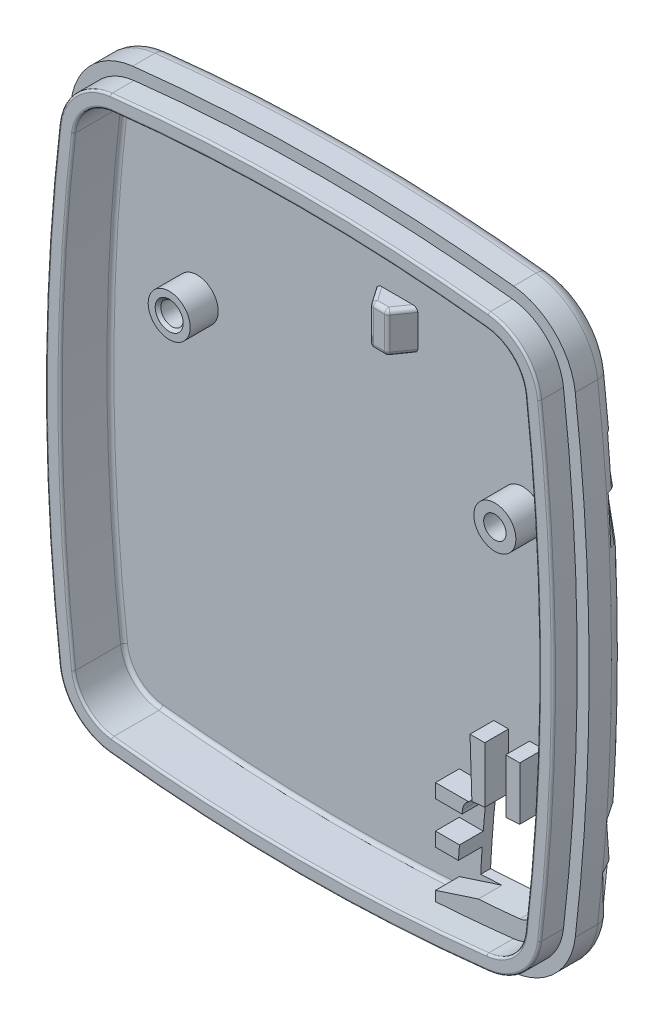
from build123d import *

# Parameters (mm, degrees)
IZIM1_W                           = 38
IZIM1_H                           = 44
Y_KSEKLIK_EKSTR_ZYON1_DEPTH       = 1.3
KES_EKSTR_ZYON1_DEPTH             = 30.184927617
KES_EKSTR_ZYON2_DEPTH             = 30.184927617
RADYUS1_R                         = 5
RADYUS2_R                         = 1
BO_ALTMA1_T                       = -0.7
Y_KSEKLIK_EKSTR_ZYON10_DEPTH      = 1.7
Y_KSEKLIK_EKSTR_ZYON10_DEPTH_BACK = 1.9
KES_EKSTR_ZYON5_DEPTH             = 1.7
RADYUS3_R                         = 0.15
IZIM14_R                          = 1.5
IZIM14_R_2                        = 0.8
Y_KSEKLIK_EKSTR_ZYON13_DEPTH      = 2
RADYUS6_R                         = 0.25
Y_KSEKLIK_EKSTR_ZYON15_DEPTH      = 1.1
Y_KSEKLIK_EKSTR_ZYON15_DEPTH_BACK = 0.2
IZIM17_W                          = 3.777976332
IZIM17_H                          = 2.881557519
Y_KSEKLIK_EKSTR_ZYON16_DEPTH      = 2.4
Y_KSEKLIK_EKSTR_ZYON18_OUTLINE_W  = 4.462087673
Y_KSEKLIK_EKSTR_ZYON18_OUTLINE_H  = 1.556542211
Y_KSEKLIK_EKSTR_ZYON18_DEPTH      = 0.4
Y_KSEKLIK_EKSTR_ZYON19_START      = -1.935
Y_KSEKLIK_EKSTR_ZYON19_OUTLINE_R  = 0.75
Y_KSEKLIK_EKSTR_ZYON19_DEPTH      = 0.635
RADYUS9_R                         = 0.6
PAH1_SIZE                         = 0.2
PAH2_SIZE                         = 1.9
PAH2_SIZE_2                       = 1.330394323
RADYUS10_R                        = 0.3
RADYUS11_R                        = 1.7
Y_KSEKLIK_EKSTR_ZYON22_DEPTH      = 0.1
Y_KSEKLIK_EKSTR_ZYON22_DEPTH_BACK = 0.2
IZIM33_R                          = 4
IZIM34_R                          = 0.763160631
Y_KSEKLIK_EKSTR_ZYON23_DEPTH      = 0.2
KES_EKSTR_ZYON7_DEPTH             = 10
IZIM36_W                          = 4
IZIM36_H                          = 2
IZIM36_W_2                        = 1.5
IZIM36_H_2                        = 4.5
KES_EKSTR_ZYON8_DEPTH             = 1.7


# Read off the part's stored shape, not the designer's step: Yükseklik-Ekstrüzyon18, Yükseklik-Ekstrüzyon19
with BuildPart() as part:
    # Çizim1 → Yükseklik-Ekstrüzyon1 (new, symmetric)
    with BuildSketch(Plane.XY):
        Rectangle(IZIM1_W, IZIM1_H)
    extrude(amount=Y_KSEKLIK_EKSTR_ZYON1_DEPTH, both=True)

    # Çizim2 → Kes-Ekstrüzyon1 (cut, through all)
    with BuildSketch(Plane.XY.offset(1.3)):
        with BuildLine():
            Line((19, 22), (0, 22))
            ThreePointArc((0, 22), (9.529559276, 21.624417499), (19, 20.5))
            Line((19, 20.5), (19, 22))
        make_face()
        with BuildLine():
            Line((0, 22), (-19, 22))
            Line((-19, 22), (-19, 20.5))
            ThreePointArc((-19, 20.5), (-9.529559276, 21.624417499), (0, 22))
        make_face()
        with BuildLine():
            ThreePointArc((0, -22), (-9.529559276, -21.624417499), (-19, -20.5))
            Line((-19, -20.5), (-19, -22))
            Line((-19, -22), (0, -22))
        make_face()
        with BuildLine():
            Line((19, -22), (19, -20.5))
            ThreePointArc((19, -20.5), (9.529559276, -21.624417499), (0, -22))
            Line((0, -22), (19, -22))
        make_face()
    extrude(amount=-KES_EKSTR_ZYON1_DEPTH, mode=Mode.SUBTRACT)

    # Çizim3 → Kes-Ekstrüzyon2 (cut, through all)
    with BuildSketch(Plane.XY.offset(1.3)):
        with BuildLine():
            Line((19, 0), (19, 20.5))
            ThreePointArc((19, 20.5), (18.250358245, 20.61670023), (17.5, 20.728701167))
            ThreePointArc((17.5, 20.728701167), (18.624510362, 10.391451439), (19, 0))
        make_face()
        with BuildLine():
            Line((19, -20.5), (19, 0))
            ThreePointArc((19, 0), (18.624510362, -10.391451439), (17.5, -20.728701167))
            ThreePointArc((17.5, -20.728701167), (18.250358245, -20.61670023), (19, -20.5))
        make_face()
        with BuildLine():
            ThreePointArc((-19, -20.5), (-18.250358245, -20.61670023), (-17.5, -20.728701167))
            ThreePointArc((-17.5, -20.728701167), (-18.624510362, -10.391451439), (-19, 0))
            Line((-19, 0), (-19, -20.5))
        make_face()
        with BuildLine():
            ThreePointArc((-19, 0), (-18.624510362, 10.391451439), (-17.5, 20.728701167))
            ThreePointArc((-17.5, 20.728701167), (-18.250358245, 20.61670023), (-19, 20.5))
            Line((-19, 20.5), (-19, 0))
        make_face()
    extrude(amount=-KES_EKSTR_ZYON2_DEPTH, mode=Mode.SUBTRACT)

    # Radyus1
    radyus1_edges = [part.edges().sort_by_distance(p)[0] for p in [
        (17.5, 20.728701167, 0),
        (17.5, -20.728701167, 0),
        (-17.5, -20.728701167, 0),
        (-17.5, 20.728701167, 0),
    ]]
    fillet(radyus1_edges, radius=RADYUS1_R)

    # Radyus2
    radyus2_edges = [part.edges().sort_by_distance(p)[0] for p in [
        (-19, 0, -1.3),
        (0, -22, -1.3),
        (0, 22, -1.3),
        (19, 0, -1.3),
        (16.572210545, 19.808510803, -1.3),
        (-16.572210545, 19.808510803, -1.3),
        (16.572210545, -19.808510803, -1.3),
        (-16.572210545, -19.808510803, -1.3),
    ]]
    fillet(radyus2_edges, radius=RADYUS2_R)

    # İç Boşaltma1
    bo_altma1_openings = [part.faces().sort_by_distance(p)[0] for p in [
        (0, 0, 1.3),
    ]]
    offset(amount=BO_ALTMA1_T, openings=bo_altma1_openings)



with BuildPart() as body_2:
    # Çizim10 → Yükseklik-Ekstrüzyon10 (new, two sides: drawn at the far end of the back side and taken through both)
    with BuildSketch(Plane.XY.offset(1.3).offset(-Y_KSEKLIK_EKSTR_ZYON10_DEPTH_BACK)):
        with BuildLine():
            ThreePointArc((-17.315423097, -16.767939039), (-16.07839717, -19.312377404), (-13.528188636, -20.53746359))
            ThreePointArc((-13.528188636, -20.53746359), (0, -21.3), (13.528188636, -20.53746359))
            ThreePointArc((13.528188636, -20.53746359), (16.07839717, -19.312377404), (17.315423097, -16.767939039))
            ThreePointArc((17.315423097, -16.767939039), (18.3, 0), (17.315423097, 16.767939039))
            ThreePointArc((17.315423097, 16.767939039), (16.07839717, 19.312377404), (13.528188636, 20.53746359))
            ThreePointArc((13.528188636, 20.53746359), (0, 21.3), (-13.528188636, 20.53746359))
            ThreePointArc((-13.528188636, 20.53746359), (-16.07839717, 19.312377404), (-17.315423097, 16.767939039))
            ThreePointArc((-17.315423097, 16.767939039), (-18.3, 0), (-17.315423097, -16.767939039))
        make_face()
        with BuildLine():
            ThreePointArc((13.393337524, 19.345064673), (0, 20.1), (-13.393337524, 19.345064673))
            ThreePointArc((-13.393337524, 19.345064673), (-15.231859956, 18.461863004), (-16.123669345, 16.627500462))
            ThreePointArc((-16.123669345, 16.627500462), (-17.1, 0), (-16.123669345, -16.627500462))
            ThreePointArc((-16.123669345, -16.627500462), (-15.231859956, -18.461863004), (-13.393337524, -19.345064673))
            ThreePointArc((-13.393337524, -19.345064673), (0, -20.1), (13.393337524, -19.345064673))
            ThreePointArc((13.393337524, -19.345064673), (15.231859956, -18.461863004), (16.123669345, -16.627500462))
            ThreePointArc((16.123669345, -16.627500462), (17.1, 0), (16.123669345, 16.627500462))
            ThreePointArc((16.123669345, 16.627500462), (15.231859956, 18.461863004), (13.393337524, 19.345064673))
        make_face(mode=Mode.SUBTRACT)
    extrude(amount=Y_KSEKLIK_EKSTR_ZYON10_DEPTH + Y_KSEKLIK_EKSTR_ZYON10_DEPTH_BACK)

    # Çizim13 → Kes-Ekstrüzyon5 (cut)
    with BuildSketch(Plane.XY.offset(3)):
        with BuildLine():
            ThreePointArc((-17.315423097, 16.767939039), (-18.3, 0), (-17.315423097, -16.767939039))
            ThreePointArc((-17.315423097, -16.767939039), (-16.07839717, -19.312377404), (-13.528188636, -20.53746359))
            ThreePointArc((-13.528188636, -20.53746359), (0, -21.3), (13.528188636, -20.53746359))
            ThreePointArc((13.528188636, -20.53746359), (16.07839717, -19.312377404), (17.315423097, -16.767939039))
            ThreePointArc((17.315423097, -16.767939039), (18.3, 0), (17.315423097, 16.767939039))
            ThreePointArc((17.315423097, 16.767939039), (16.07839717, 19.312377404), (13.528188636, 20.53746359))
            ThreePointArc((13.528188636, 20.53746359), (0, 21.3), (-13.528188636, 20.53746359))
            ThreePointArc((-13.528188636, 20.53746359), (-16.07839717, 19.312377404), (-17.315423097, 16.767939039))
        make_face()
        with BuildLine():
            ThreePointArc((13.511332247, 20.388413726), (0, 21.15), (-13.511332247, 20.388413726))
            ThreePointArc((-13.511332247, 20.388413726), (-15.972580018, 19.206063104), (-17.166453878, 16.750384217))
            ThreePointArc((-17.166453878, 16.750384217), (-18.15, 0), (-17.166453878, -16.750384217))
            ThreePointArc((-17.166453878, -16.750384217), (-15.972580018, -19.206063104), (-13.511332247, -20.388413726))
            ThreePointArc((-13.511332247, -20.388413726), (0, -21.15), (13.511332247, -20.388413726))
            ThreePointArc((13.511332247, -20.388413726), (15.972580018, -19.206063104), (17.166453878, -16.750384217))
            ThreePointArc((17.166453878, -16.750384217), (18.15, 0), (17.166453878, 16.750384217))
            ThreePointArc((17.166453878, 16.750384217), (15.972580018, 19.206063104), (13.511332247, 20.388413726))
        make_face(mode=Mode.SUBTRACT)
    extrude(amount=-KES_EKSTR_ZYON5_DEPTH, mode=Mode.SUBTRACT)

    # Radyus3
    radyus3_edges = [body_2.edges().sort_by_distance(p)[0] for p in [
        (15.231859956, 18.461863004, 3),
        (0, 20.1, 3),
        (-15.231859956, 18.461863004, 3),
        (-17.1, 0, 3),
        (-15.231859956, -18.461863004, 3),
        (0, -20.1, 3),
        (15.231859956, -18.461863004, 3),
        (17.1, 0, 3),
        (15.972580018, 19.206063104, 3),
        (18.15, 0, 3),
        (15.972580018, -19.206063104, 3),
        (0, -21.15, 3),
        (-15.972580018, -19.206063104, 3),
        (-18.15, 0, 3),
        (-15.972580018, 19.206063104, 3),
        (0, 21.15, 3),
    ]]
    fillet(radyus3_edges, radius=RADYUS3_R)


with BuildPart() as part_1:
    add(part.part)

    add(body_2.part)  # Yükseklik-Ekstrüzyon13 merges body 2
    # Çizim14 → Yükseklik-Ekstrüzyon13 (add)
    # profile 1 of 2: a face of its own
    with BuildSketch(Plane.XY.offset(-0.6)):
        with Locations(Location((-10.899348707, 7.219150932, 0), (0, 0, 180))):
            Circle(IZIM14_R)
        with Locations((-10.899348707, 7.219150932)):
            Circle(IZIM14_R_2, mode=Mode.SUBTRACT)
    # profile 2 of 2: a face of its own
    with BuildSketch(Plane.XY.offset(-0.6)):
        with Locations(Location((12.365990888, 5.750657834, 0), (0, 0, 180))):
            Circle(IZIM14_R)
        with Locations((12.365990888, 5.750657834)):
            Circle(IZIM14_R_2, mode=Mode.SUBTRACT)
    extrude(amount=Y_KSEKLIK_EKSTR_ZYON13_DEPTH)

    # Radyus6
    radyus6_edges = [part_1.edges().sort_by_distance(p)[0] for p in [
        (17.1, 0, -0.6),
        (15.231859956, 18.461863004, -0.6),
        (0, 20.1, -0.6),
        (-15.231859956, 18.461863004, -0.6),
        (-17.1, 0, -0.6),
        (-15.231859956, -18.461863004, -0.6),
        (0, -20.1, -0.6),
        (15.231859956, -18.461863004, -0.6),
    ]]
    fillet(radyus6_edges, radius=RADYUS6_R)

    # Çizim20 → Yükseklik-Ekstrüzyon16 (add)
    with BuildSketch(Plane(origin=(0, 0, -1.3), x_dir=(-1, 0, 0), z_dir=(0, 0, -1))):
        Polygon((-17.010609627, -8.248510803), (-16.75506951, -16.423522843), (-15.705648654, -18.872171507), (-13.373602307, -19.993354001), (-7.822210545, -19.993354001), (-7.822210545, -8.248510803), align=None)
    extrude(amount=-Y_KSEKLIK_EKSTR_ZYON16_DEPTH)

    # Yükseklik-Ekstrüzyon18 outline → Yükseklik-Ekstrüzyon18 (add)
    # profile 1 of 9: a face of its own
    with BuildSketch(Plane(origin=(0, 0, -1.3), x_dir=(-1, 0, 0), z_dir=(0, 0, -1))):
        with BuildLine():
            add(Edge.make_bspline(
                [(12.118367005, -9.482808521), (12.091880497, -9.48291382), (12.041867707, -9.48311265), (11.970803059, -9.485904145), (11.90831427, -9.488622522), (11.853948015, -9.493540095), (11.808151869, -9.499658497), (11.770372058, -9.507510039), (11.740978928, -9.517024279), (11.712578237, -9.530538402), (11.686317962, -9.555004828), (11.666544013, -9.593198708), (11.652900211, -9.63890303), (11.651926387, -9.672393805), (11.651404341, -9.690347482)],
                knots=[0, 0, 0, 0, 0.135204718, 0.255298483, 0.3630462, 0.45447317, 0.533879273, 0.598821629, 0.651172559, 0.691275066, 0.758648293, 0.82966591, 0.908687594, 1, 1, 1, 1], degree=3))
            Line((12.118367005, -9.482808521), (13.623024476, -9.482808521))
            Line((13.623024476, -9.482808521), (13.623024476, -8.03003579))
            Line((13.623024476, -8.03003579), (12.419136359, -8.03003579))
            add(Edge.make_bspline(
                [(11.314964228, -8.788039419), (11.317062174, -8.75801293), (11.321118336, -8.699959799), (11.332397364, -8.61654582), (11.34780333, -8.539908247), (11.366699794, -8.469939251), (11.391285928, -8.407078258), (11.419641216, -8.350796065), (11.451733054, -8.300806663), (11.500226471, -8.246113688), (11.562419933, -8.190013261), (11.633993622, -8.133335083), (11.701789418, -8.091147069), (11.759689265, -8.068191793), (11.810748879, -8.056202575), (11.86066885, -8.049293804), (11.922964144, -8.044341352), (11.997757372, -8.038133057), (12.085368812, -8.034439426), (12.185645657, -8.032272406), (12.298337357, -8.03060783), (12.377519873, -8.030232863), (12.419136359, -8.03003579)],
                knots=[0, 0, 0, 0, 0.057749972, 0.111653638, 0.161384845, 0.207685759, 0.250539078, 0.290660311, 0.328487367, 0.364148125, 0.430567385, 0.488965629, 0.539213259, 0.583221344, 0.607748032, 0.639723137, 0.679817551, 0.727663726, 0.783729083, 0.848050361, 0.920138808, 1, 1, 1, 1], degree=3))
            add(Edge.make_bspline(
                [(10.39968498, -8.03003579), (10.440773487, -8.030408375), (10.519795704, -8.03112494), (10.63350644, -8.039166316), (10.737167124, -8.052863048), (10.831106831, -8.071002989), (10.914883838, -8.095367676), (10.989349707, -8.124212349), (11.054119041, -8.158744508), (11.108967073, -8.200458649), (11.156101222, -8.248145875), (11.195756356, -8.303608511), (11.231331966, -8.365411153), (11.258847184, -8.435943945), (11.282859633, -8.512980977), (11.299309701, -8.598095345), (11.310768625, -8.690469813), (11.313533397, -8.754765146), (11.314964228, -8.788039419)],
                knots=[0, 0, 0, 0, 0.089184998, 0.171522325, 0.247270212, 0.316068583, 0.379002164, 0.436410953, 0.489174977, 0.537748439, 0.58545333, 0.634147084, 0.685372273, 0.739840404, 0.798108953, 0.860349726, 0.927727859, 1, 1, 1, 1], degree=3))
            add(Edge.make_bspline(
                [(9.160936803, -10.224598168), (9.16102192, -10.14622951), (9.161185412, -9.995699972), (9.164367327, -9.779223143), (9.17006806, -9.581402536), (9.177392544, -9.402500776), (9.185483166, -9.242669918), (9.197973132, -9.101883377), (9.211505704, -8.979953432), (9.226265955, -8.873856856), (9.247412743, -8.779719274), (9.272634382, -8.691716217), (9.306479387, -8.609109055), (9.345195666, -8.53025376), (9.391966543, -8.456758077), (9.443604586, -8.386531754), (9.502433, -8.321580214), (9.5674802, -8.260836609), (9.640896268, -8.206531127), (9.722445144, -8.157904648), (9.813989746, -8.118614126), (9.914048869, -8.086673622), (10.022541054, -8.060076957), (10.140399524, -8.0433963), (10.267016795, -8.031234422), (10.354523141, -8.030443819), (10.39968498, -8.03003579)],
                knots=[0, 0, 0, 0, 0.079725817, 0.153136352, 0.220243204, 0.281049773, 0.335292386, 0.383031116, 0.424805529, 0.460108295, 0.491924878, 0.522891582, 0.553113479, 0.582620451, 0.612140226, 0.641611317, 0.671200139, 0.701159565, 0.732005221, 0.763924969, 0.797533254, 0.833090932, 0.870698054, 0.911016939, 0.954076031, 1, 1, 1, 1], degree=3))
            Line((9.160936803, -10.224598168), (9.160936803, -11.246889694))
            Line((9.160936803, -11.246889694), (13.623024476, -11.246889694))
            Line((13.623024476, -11.246889694), (13.623024476, -9.690347482))
            Line((13.623024476, -9.690347482), (11.651404341, -9.690347482))
        make_face()
        with BuildLine():
            add(Edge.make_bspline(
                [(10.281322916, -9.482808521), (10.252890403, -9.483457227), (10.201690983, -9.484625375), (10.132772311, -9.49551634), (10.07932982, -9.513206842), (10.04205633, -9.541992902), (10.019671149, -9.576122033), (10.002791352, -9.61151538), (9.992897811, -9.650097278), (9.991701049, -9.676781819), (9.991092649, -9.690347482)],
                knots=[0, 0, 0, 0, 0.207755591, 0.374112754, 0.509202691, 0.614768302, 0.711267723, 0.804995066, 0.900865026, 1, 1, 1, 1], degree=3))
            Line((10.281322916, -9.482808521), (10.525343335, -9.482808521))
            add(Edge.make_bspline(
                [(10.873133236, -9.690347482), (10.871018555, -9.664222954), (10.866911237, -9.613481602), (10.844355334, -9.558396387), (10.817560429, -9.528737079), (10.795758621, -9.516263115), (10.76747295, -9.505968169), (10.732453243, -9.497070431), (10.690312725, -9.491168265), (10.641361666, -9.486339131), (10.585650171, -9.482985998), (10.546156504, -9.482869772), (10.525343335, -9.482808521)],
                knots=[0, 0, 0, 0, 0.166092219, 0.322598885, 0.365047389, 0.417388159, 0.479796133, 0.555892735, 0.646094533, 0.749476332, 0.867973991, 1, 1, 1, 1], degree=3))
            Line((10.873133236, -9.690347482), (9.991092649, -9.690347482))
        make_face(mode=Mode.SUBTRACT)
    # profile 2 of 9: a face of its own
    with BuildSketch(Plane(origin=(0, 0, -1.3), x_dir=(-1, 0, 0), z_dir=(0, 0, -1))):
        with BuildLine():
            add(Edge.make_bspline(
                [(9.057167322, -4.246154217), (9.058794881, -4.174214953), (9.061972731, -4.033751699), (9.084727917, -3.82810577), (9.123605114, -3.633091274), (9.177259337, -3.449336151), (9.246150074, -3.279340213), (9.331884624, -3.126914738), (9.430773225, -2.991060154), (9.545672045, -2.876394153), (9.668807183, -2.781073251), (9.797565761, -2.705889353), (9.930608523, -2.651872362), (10.047760097, -2.626951796), (10.148276192, -2.616036395), (10.236115954, -2.607870573), (10.336377205, -2.600587666), (10.448825213, -2.595040181), (10.573431172, -2.591302336), (10.710435192, -2.587790656), (10.859889801, -2.586519799), (10.963661392, -2.586073701), (11.01743767, -2.585842525)],
                knots=[0, 0, 0, 0, 0.071156086, 0.138934077, 0.204360269, 0.267628769, 0.328042607, 0.385371601, 0.440225967, 0.493719081, 0.545369064, 0.59387776, 0.640786826, 0.686772042, 0.711805655, 0.740799195, 0.77403348, 0.811237386, 0.852158453, 0.897347383, 0.946803594, 1, 1, 1, 1], degree=3))
            add(Edge.make_bspline(
                [(11.01743767, -5.854581169), (10.96393053, -5.85439323), (10.860697281, -5.854030633), (10.712073473, -5.852185362), (10.575287493, -5.850578536), (10.45076099, -5.84481203), (10.338001896, -5.840768517), (10.237226272, -5.833914774), (10.148499129, -5.827090941), (10.046507317, -5.815652242), (9.928237128, -5.791875793), (9.794007293, -5.740475071), (9.665576791, -5.668747355), (9.54322794, -5.578068126), (9.430591777, -5.468032414), (9.331988531, -5.339092826), (9.247304429, -5.193676619), (9.177864525, -5.031596605), (9.123934819, -4.854251543), (9.085555601, -4.663112247), (9.061653942, -4.458890273), (9.058690448, -4.318374247), (9.057167322, -4.246154217)],
                knots=[0, 0, 0, 0, 0.053608009, 0.103427861, 0.148920116, 0.190646336, 0.228314806, 0.261956867, 0.291838231, 0.317461837, 0.364773927, 0.412243015, 0.460839878, 0.511740483, 0.564390982, 0.618057073, 0.673872393, 0.732566435, 0.794313299, 0.859251815, 0.92766065, 1, 1, 1, 1], degree=3))
            Line((11.01743767, -5.854581169), (11.766523609, -5.854581169))
            add(Edge.make_bspline(
                [(13.726793957, -4.246154217), (13.725427858, -4.315389373), (13.722752558, -4.450976079), (13.700827, -4.649021797), (13.663519017, -4.836434329), (13.612093138, -5.012231463), (13.546521097, -5.175435679), (13.463117367, -5.322235446), (13.365403152, -5.453634555), (13.252933191, -5.566498186), (13.130743791, -5.660804348), (13.001920323, -5.734456804), (12.868012333, -5.787603552), (12.750329866, -5.813591692), (12.648381874, -5.824397243), (12.559461893, -5.832507904), (12.45812258, -5.839837736), (12.344324862, -5.845418221), (12.21782576, -5.849111313), (12.078660171, -5.852624752), (11.926773823, -5.853910905), (11.821380829, -5.854351723), (11.766523609, -5.854581169)],
                knots=[0, 0, 0, 0, 0.069361909, 0.135834932, 0.199347161, 0.260608178, 0.319138762, 0.3751603, 0.429315834, 0.482735953, 0.534295463, 0.583532345, 0.630949374, 0.67811757, 0.703744355, 0.733652727, 0.767587554, 0.805543785, 0.847806793, 0.894393145, 0.945031466, 1, 1, 1, 1], degree=3))
            add(Edge.make_bspline(
                [(11.766523609, -2.585842525), (11.819219585, -2.586042329), (11.920830577, -2.5864276), (12.067298825, -2.588115462), (12.201892513, -2.590260114), (12.324600697, -2.594213816), (12.435662084, -2.600006051), (12.53512249, -2.606387215), (12.622759642, -2.613383674), (12.723670325, -2.624805652), (12.841162352, -2.648530495), (12.975090201, -2.700255944), (13.104073121, -2.772413308), (13.226969204, -2.865134973), (13.341923116, -2.976859684), (13.442500573, -3.109446462), (13.528743134, -3.260345828), (13.600616183, -3.428489225), (13.656659998, -3.612922199), (13.698078157, -3.811440857), (13.722440586, -4.024225494), (13.725313742, -4.170694925), (13.726793957, -4.246154217)],
                knots=[0, 0, 0, 0, 0.052107752, 0.100476752, 0.144841806, 0.185213496, 0.221869806, 0.254806787, 0.283766119, 0.308790412, 0.355224479, 0.401825094, 0.450152003, 0.500922991, 0.553643104, 0.608157733, 0.664900664, 0.725110244, 0.788586777, 0.855196428, 0.925398939, 1, 1, 1, 1], degree=3))
            Line((11.766523609, -2.585842525), (11.01743767, -2.585842525))
        make_face()
        with BuildLine():
            add(Edge.make_bspline(
                [(10.316182975, -4.142384737), (10.292400075, -4.142209018), (10.247529948, -4.141877497), (10.183770238, -4.144073992), (10.127266957, -4.145296381), (10.078074466, -4.147720205), (10.036134268, -4.150759589), (10.001879944, -4.155052587), (9.974277665, -4.158375113), (9.948818553, -4.165680505), (9.924490968, -4.176078587), (9.902914577, -4.193479969), (9.88939765, -4.216006875), (9.888024973, -4.232736644), (9.887323168, -4.241290023)],
                knots=[0, 0, 0, 0, 0.150823581, 0.284552058, 0.40457432, 0.509248844, 0.5969264, 0.671120842, 0.728325207, 0.772820751, 0.838778239, 0.894736625, 0.946182312, 1, 1, 1, 1], degree=3))
            Line((10.316182975, -4.142384737), (12.350226939, -4.142384737))
            add(Edge.make_bspline(
                [(12.896638111, -4.248586314), (12.895839192, -4.238882557), (12.894260269, -4.219704771), (12.876968515, -4.194576015), (12.849607834, -4.176516331), (12.819740395, -4.165580928), (12.787736288, -4.158298633), (12.753157315, -4.155101517), (12.709442354, -4.150671608), (12.655883458, -4.147760173), (12.592914909, -4.145294146), (12.520472748, -4.144057622), (12.43860381, -4.141883671), (12.380765109, -4.142211596), (12.350226939, -4.142384737)],
                knots=[0, 0, 0, 0, 0.048585199, 0.096020173, 0.148029396, 0.212566793, 0.256048555, 0.313918305, 0.388116605, 0.47858284, 0.585380571, 0.707180231, 0.84539452, 1, 1, 1, 1], degree=3))
            add(Edge.make_bspline(
                [(12.382654901, -4.298038958), (12.413191521, -4.298104734), (12.47102327, -4.298229304), (12.552637521, -4.297406255), (12.62399424, -4.295988741), (12.685050027, -4.293288229), (12.736161329, -4.291165726), (12.777283887, -4.288187098), (12.808407461, -4.284191263), (12.835318257, -4.279187337), (12.858923172, -4.272367114), (12.877526776, -4.262107065), (12.892147557, -4.257492556), (12.895457007, -4.250928832), (12.896638111, -4.248586314)],
                knots=[0, 0, 0, 0, 0.175019535, 0.331460592, 0.467794188, 0.58405049, 0.681738322, 0.760972023, 0.820335453, 0.861343311, 0.918167156, 0.959057849, 0.985388221, 1, 1, 1, 1], degree=3))
            Line((12.382654901, -4.298038958), (10.316182975, -4.298038958))
            add(Edge.make_bspline(
                [(9.887323168, -4.241290023), (9.888084427, -4.242424334), (9.890830804, -4.246516568), (9.900757498, -4.250778542), (9.914130766, -4.260429435), (9.929954352, -4.271063524), (9.950517881, -4.279345634), (9.976203444, -4.283011992), (10.01040172, -4.288314346), (10.053724042, -4.292143564), (10.106478524, -4.294001994), (10.168066844, -4.297011604), (10.239170175, -4.297118107), (10.289431284, -4.297719085), (10.316182975, -4.298038958)],
                knots=[0, 0, 0, 0, 0.009199604, 0.033189236, 0.070444793, 0.122518127, 0.162151234, 0.220247298, 0.298308526, 0.398089248, 0.515973477, 0.657754866, 0.817838549, 1, 1, 1, 1], degree=3))
        make_face(mode=Mode.SUBTRACT)
    # profile 3 of 9: a face of its own
    with BuildSketch(Plane(origin=(0, 0, -1.3), x_dir=(-1, 0, 0), z_dir=(0, 0, -1))):
        with BuildLine():
            add(Edge.make_bspline(
                [(9.160936803, -0.380971898), (9.238253616, -0.366263245), (9.395956951, -0.33626196), (9.636647883, -0.287419943), (9.887244369, -0.239801171), (10.057062969, -0.205490398), (10.143504074, -0.18802552)],
                knots=[0, 0, 0, 0, 0.23579309, 0.48094787, 0.735791961, 1, 1, 1, 1], degree=3))
            Line((9.160936803, -0.380971898), (9.160936803, -2.27638632))
            Line((9.160936803, -2.27638632), (13.623024476, -2.27638632))
            Line((13.623024476, -2.27638632), (13.623024476, -0.929815168))
            Line((13.623024476, -0.929815168), (10.732882297, -0.911979788))
            Line((10.732882297, -0.911979788), (13.623024476, -0.609589035))
            Line((13.623024476, -0.609589035), (13.623024476, 0.46539793))
            Line((13.623024476, 0.46539793), (10.680997556, 0.767788682))
            Line((10.680997556, 0.767788682), (13.623024476, 0.785624062))
            Line((13.623024476, 0.785624062), (13.623024476, 2.133816613))
            Line((13.623024476, 2.133816613), (9.160936803, 2.133816613))
            Line((9.160936803, 2.133816613), (9.160936803, 0.234348695))
            Line((9.160936803, 0.234348695), (11.195791465, -0.052638775))
            Line((11.195791465, -0.052638775), (10.143504074, -0.18802552))
        make_face()
    # profile 4 of 9: a face of its own
    with BuildSketch(Plane(origin=(0, 0, -1.3), x_dir=(-1, 0, 0), z_dir=(0, 0, -1))):
        with BuildLine():
            add(Edge.make_bspline(
                [(9.057167322, 4.10358451), (9.058794881, 4.175523774), (9.061972731, 4.315987028), (9.084727917, 4.521632956), (9.123605114, 4.716647453), (9.177259337, 4.900402576), (9.246150074, 5.070398514), (9.331884624, 5.222823989), (9.430773225, 5.358678573), (9.545672045, 5.473344574), (9.668807183, 5.568665476), (9.797565761, 5.643849374), (9.930608523, 5.697866365), (10.047760097, 5.722786931), (10.148276192, 5.733702332), (10.236115954, 5.741868154), (10.336377205, 5.749151061), (10.448825213, 5.754698546), (10.573431172, 5.758436391), (10.710435192, 5.76194807), (10.859889801, 5.763218928), (10.963661392, 5.763665026), (11.01743767, 5.763896202)],
                knots=[0, 0, 0, 0, 0.071156086, 0.138934077, 0.204360269, 0.267628769, 0.328042607, 0.385371601, 0.440225967, 0.493719081, 0.545369064, 0.59387776, 0.640786826, 0.686772042, 0.711805655, 0.740799195, 0.77403348, 0.811237386, 0.852158453, 0.897347383, 0.946803594, 1, 1, 1, 1], degree=3))
            add(Edge.make_bspline(
                [(11.01743767, 2.495157557), (10.96393053, 2.495345496), (10.860697281, 2.495708094), (10.712073473, 2.497553365), (10.575287493, 2.499160191), (10.45076099, 2.504926697), (10.338001896, 2.508970209), (10.237226272, 2.515823953), (10.148499129, 2.522647786), (10.046507317, 2.534086485), (9.928237128, 2.557862933), (9.794007293, 2.609263655), (9.665576791, 2.680991372), (9.54322794, 2.7716706), (9.430591777, 2.881706313), (9.331988531, 3.010645901), (9.247304429, 3.156062108), (9.177864525, 3.318142122), (9.123934819, 3.495487184), (9.085555601, 3.68662648), (9.061653942, 3.890848453), (9.058690448, 4.03136448), (9.057167322, 4.10358451)],
                knots=[0, 0, 0, 0, 0.053608009, 0.103427861, 0.148920116, 0.190646336, 0.228314806, 0.261956867, 0.291838231, 0.317461837, 0.364773927, 0.412243015, 0.460839878, 0.511740483, 0.564390982, 0.618057073, 0.673872393, 0.732566435, 0.794313299, 0.859251815, 0.92766065, 1, 1, 1, 1], degree=3))
            Line((11.01743767, 2.495157557), (11.766523609, 2.495157557))
            add(Edge.make_bspline(
                [(13.726793957, 4.10358451), (13.725427858, 4.034349353), (13.722752558, 3.898762648), (13.700827, 3.70071693), (13.663519017, 3.513304398), (13.612093138, 3.337507264), (13.546521097, 3.174303048), (13.463117367, 3.02750328), (13.365403152, 2.896104172), (13.252933191, 2.783240541), (13.130743791, 2.688934378), (13.001920323, 2.615281923), (12.868012333, 2.562135175), (12.750329866, 2.536147035), (12.648381874, 2.525341483), (12.559461893, 2.517230823), (12.45812258, 2.509900991), (12.344324862, 2.504320506), (12.21782576, 2.500627414), (12.078660171, 2.497113975), (11.926773823, 2.495827821), (11.821380829, 2.495387004), (11.766523609, 2.495157557)],
                knots=[0, 0, 0, 0, 0.069361909, 0.135834932, 0.199347161, 0.260608178, 0.319138762, 0.3751603, 0.429315834, 0.482735953, 0.534295463, 0.583532345, 0.630949374, 0.67811757, 0.703744355, 0.733652727, 0.767587554, 0.805543785, 0.847806793, 0.894393145, 0.945031466, 1, 1, 1, 1], degree=3))
            add(Edge.make_bspline(
                [(11.766523609, 5.763896202), (11.819219585, 5.763696398), (11.920830577, 5.763311127), (12.067298825, 5.761623264), (12.201892513, 5.759478613), (12.324600697, 5.755524911), (12.435662084, 5.749732676), (12.53512249, 5.743351512), (12.622759642, 5.736355052), (12.723670325, 5.724933075), (12.841162352, 5.701208232), (12.975090201, 5.649482782), (13.104073121, 5.577325419), (13.226969204, 5.484603753), (13.341923116, 5.372879042), (13.442500573, 5.240292265), (13.528743134, 5.089392899), (13.600616183, 4.921249502), (13.656659998, 4.736816528), (13.698078157, 4.53829787), (13.722440586, 4.325513233), (13.725313742, 4.179043802), (13.726793957, 4.10358451)],
                knots=[0, 0, 0, 0, 0.052107752, 0.100476752, 0.144841806, 0.185213496, 0.221869806, 0.254806787, 0.283766119, 0.308790412, 0.355224479, 0.401825094, 0.450152003, 0.500922991, 0.553643104, 0.608157733, 0.664900664, 0.725110244, 0.788586777, 0.855196428, 0.925398939, 1, 1, 1, 1], degree=3))
            Line((11.766523609, 5.763896202), (11.01743767, 5.763896202))
        make_face()
        with BuildLine():
            add(Edge.make_bspline(
                [(10.316182975, 4.20735399), (10.292400075, 4.207529709), (10.247529948, 4.20786123), (10.183770238, 4.205664735), (10.127266957, 4.204442346), (10.078074466, 4.202018522), (10.036134268, 4.198979138), (10.001879944, 4.19468614), (9.974277665, 4.191363614), (9.948818553, 4.184058222), (9.924490968, 4.17366014), (9.902914577, 4.156258758), (9.88939765, 4.133731851), (9.888024973, 4.117002082), (9.887323168, 4.108448704)],
                knots=[0, 0, 0, 0, 0.150823581, 0.284552058, 0.40457432, 0.509248844, 0.5969264, 0.671120842, 0.728325207, 0.772820751, 0.838778239, 0.894736625, 0.946182312, 1, 1, 1, 1], degree=3))
            Line((10.316182975, 4.20735399), (12.350226939, 4.20735399))
            add(Edge.make_bspline(
                [(12.896638111, 4.101152412), (12.895839192, 4.11085617), (12.894260269, 4.130033956), (12.876968515, 4.155162712), (12.849607834, 4.173222395), (12.819740395, 4.184157799), (12.787736288, 4.191440094), (12.753157315, 4.19463721), (12.709442354, 4.199067119), (12.655883458, 4.201978553), (12.592914909, 4.204444581), (12.520472748, 4.205681105), (12.43860381, 4.207855056), (12.380765109, 4.207527131), (12.350226939, 4.20735399)],
                knots=[0, 0, 0, 0, 0.048585199, 0.096020173, 0.148029396, 0.212566793, 0.256048555, 0.313918305, 0.388116605, 0.47858284, 0.585380571, 0.707180231, 0.84539452, 1, 1, 1, 1], degree=3))
            add(Edge.make_bspline(
                [(12.382654901, 4.051699769), (12.413191521, 4.051633993), (12.47102327, 4.051509423), (12.552637521, 4.052332472), (12.62399424, 4.053749986), (12.685050027, 4.056450498), (12.736161329, 4.058573001), (12.777283887, 4.061551629), (12.808407461, 4.065547463), (12.835318257, 4.070551389), (12.858923172, 4.077371613), (12.877526776, 4.087631662), (12.892147557, 4.09224617), (12.895457007, 4.098809895), (12.896638111, 4.101152412)],
                knots=[0, 0, 0, 0, 0.175019535, 0.331460592, 0.467794188, 0.58405049, 0.681738322, 0.760972023, 0.820335453, 0.861343311, 0.918167156, 0.959057849, 0.985388221, 1, 1, 1, 1], degree=3))
            Line((12.382654901, 4.051699769), (10.316182975, 4.051699769))
            add(Edge.make_bspline(
                [(9.887323168, 4.108448704), (9.888084427, 4.107314392), (9.890830804, 4.103222159), (9.900757498, 4.098960185), (9.914130766, 4.089309292), (9.929954352, 4.078675203), (9.950517881, 4.070393093), (9.976203444, 4.066726735), (10.01040172, 4.061424381), (10.053724042, 4.057595163), (10.106478524, 4.055736732), (10.168066844, 4.052727122), (10.239170175, 4.05262062), (10.289431284, 4.052019642), (10.316182975, 4.051699769)],
                knots=[0, 0, 0, 0, 0.009199604, 0.033189236, 0.070444793, 0.122518127, 0.162151234, 0.220247298, 0.298308526, 0.398089248, 0.515973477, 0.657754866, 0.817838549, 1, 1, 1, 1], degree=3))
        make_face(mode=Mode.SUBTRACT)
    # profile 5 of 9: a face of its own
    with BuildSketch(Plane(origin=(0, 0, -1.3), x_dir=(-1, 0, 0), z_dir=(0, 0, -1))):
        with BuildLine():
            add(Edge.make_bspline(
                [(12.544794715, 9.445860532), (12.580740095, 9.445265962), (12.65024328, 9.444116316), (12.751214021, 9.438920813), (12.845351952, 9.428231911), (12.933087188, 9.413851778), (13.014094448, 9.395360963), (13.088617431, 9.372984129), (13.155797568, 9.345034696), (13.217622974, 9.314497823), (13.273208356, 9.278063909), (13.324831199, 9.237706741), (13.371212974, 9.190821127), (13.413435696, 9.139036041), (13.45064768, 9.081705005), (13.484370682, 9.019889774), (13.512379254, 8.952027813), (13.537529847, 8.877459451), (13.557823125, 8.791124985), (13.575125412, 8.689837164), (13.59050428, 8.571396598), (13.602067253, 8.435588558), (13.611964794, 8.28234682), (13.617886176, 8.111486744), (13.622043586, 7.923388179), (13.62268823, 7.792307372), (13.623024476, 7.72393571)],
                knots=[0, 0, 0, 0, 0.04482262, 0.08666802, 0.12599616, 0.162886147, 0.197458482, 0.229537351, 0.259757609, 0.288085492, 0.315374457, 0.342473486, 0.369633187, 0.397416857, 0.425638346, 0.454733269, 0.485082846, 0.517046499, 0.552757527, 0.595520652, 0.645126711, 0.701619949, 0.765427277, 0.836569843, 0.914754938, 1, 1, 1, 1], degree=3))
            Line((12.544794715, 9.445860532), (12.139445181, 9.445860532))
            add(Edge.make_bspline(
                [(11.210384048, 8.612461889), (11.215077986, 8.649280784), (11.224129325, 8.72027882), (11.244389751, 8.822194891), (11.269994241, 8.915564767), (11.301603799, 9.000571736), (11.33899941, 9.077042607), (11.381144559, 9.145841732), (11.428905763, 9.206479271), (11.483586448, 9.258004584), (11.543194453, 9.303238802), (11.609627558, 9.341279836), (11.682375049, 9.373920008), (11.761432613, 9.400318558), (11.846917584, 9.420661289), (11.938543221, 9.434928553), (12.036847548, 9.443971737), (12.104564637, 9.44521839), (12.139445181, 9.445860532)],
                knots=[0, 0, 0, 0, 0.078804769, 0.151959578, 0.220462389, 0.284203699, 0.3442606, 0.400955123, 0.455267335, 0.507628382, 0.560080549, 0.613822818, 0.669818879, 0.729161399, 0.790544411, 0.856209688, 0.925934733, 1, 1, 1, 1], degree=3))
            add(Edge.make_bspline(
                [(10.449137623, 9.342091051), (10.480235758, 9.341744302), (10.540115743, 9.34107663), (10.626494767, 9.332635911), (10.705914134, 9.319976383), (10.778816132, 9.302438442), (10.844711186, 9.278756255), (10.904565729, 9.250559167), (10.957548463, 9.216562883), (11.003716993, 9.176597459), (11.045458553, 9.131493166), (11.080381751, 9.077890836), (11.11348041, 9.018364594), (11.141399221, 8.95113055), (11.164875748, 8.876724369), (11.18394603, 8.795066293), (11.200561264, 8.70642274), (11.207043973, 8.644411718), (11.210384048, 8.612461889)],
                knots=[0, 0, 0, 0, 0.077428666, 0.149090205, 0.215923776, 0.277629446, 0.335536404, 0.390025479, 0.442112961, 0.491755692, 0.541784753, 0.5946149, 0.650641142, 0.711269208, 0.775552964, 0.844770627, 0.920021444, 1, 1, 1, 1], degree=3))
            add(Edge.make_bspline(
                [(9.160936803, 7.501804165), (9.161311208, 7.556122734), (9.162037771, 7.661532314), (9.165822915, 7.814805638), (9.173238206, 7.958320167), (9.182916662, 8.092390463), (9.194706533, 8.217085992), (9.209921204, 8.332324931), (9.228617114, 8.43775653), (9.249679001, 8.534724484), (9.274388717, 8.625060689), (9.306438367, 8.709327763), (9.34317784, 8.78954396), (9.384764886, 8.865620368), (9.433316639, 8.936590828), (9.486651283, 9.003328421), (9.546439712, 9.065050507), (9.611282891, 9.123176734), (9.683953623, 9.176037011), (9.766683008, 9.220124651), (9.857761509, 9.258498904), (9.958398406, 9.288926279), (10.067850725, 9.313283202), (10.186882995, 9.329712734), (10.314897457, 9.340625774), (10.403443631, 9.341592286), (10.449137623, 9.342091051)],
                knots=[0, 0, 0, 0, 0.062133536, 0.120575155, 0.175357735, 0.226495057, 0.274322775, 0.318607107, 0.359415054, 0.396764567, 0.432090752, 0.466423874, 0.49975728, 0.532962887, 0.565455875, 0.597992942, 0.630566695, 0.663629561, 0.697514488, 0.73306311, 0.770607814, 0.810401034, 0.853148388, 0.898742422, 0.947746326, 1, 1, 1, 1], degree=3))
            Line((9.160936803, 7.501804165), (9.160936803, 6.073352406))
            Line((9.160936803, 6.073352406), (13.623024476, 6.073352406))
            Line((13.623024476, 6.073352406), (13.623024476, 7.72393571))
        make_face()
        with BuildLine():
            add(Edge.make_bspline(
                [(10.360771424, 7.88931832), (10.331023967, 7.888899738), (10.276581517, 7.888133667), (10.202659503, 7.881717719), (10.143710859, 7.872712557), (10.099252523, 7.856739402), (10.066218579, 7.837601442), (10.04156271, 7.815903861), (10.021596843, 7.793036797), (10.005287183, 7.755952116), (9.995847223, 7.70086462), (9.992777733, 7.65504733), (9.991092649, 7.629894618)],
                knots=[0, 0, 0, 0, 0.167617016, 0.306765069, 0.418210582, 0.50254002, 0.57150695, 0.631977243, 0.687171809, 0.741004388, 0.857816951, 1, 1, 1, 1], degree=3))
            add(Edge.make_bspline(
                [(10.870701138, 7.652594192), (10.870072181, 7.676418349), (10.868932383, 7.719592549), (10.857741816, 7.777535841), (10.837531576, 7.821357662), (10.811758029, 7.848732744), (10.782009089, 7.859938718), (10.750774011, 7.867781471), (10.709831073, 7.874778506), (10.658950735, 7.880348213), (10.598334454, 7.883919446), (10.527811891, 7.887424281), (10.447519446, 7.888653751), (10.390766892, 7.889088527), (10.360771424, 7.88931832)],
                knots=[0, 0, 0, 0, 0.107580107, 0.19495695, 0.264280627, 0.323837119, 0.358294207, 0.406253532, 0.469462515, 0.545616321, 0.637359468, 0.743657985, 0.864515375, 1, 1, 1, 1], degree=3))
            add(Edge.make_bspline(
                [(10.870923494, 7.629894618), (10.871064609, 7.631256718), (10.872515265, 7.638614366), (10.871517315, 7.646304664), (10.870701138, 7.652594192)],
                knots=[0.392203083, 0.392203083, 0.392203083, 0.392203083, 0.50291196, 1, 1, 1, 1], degree=3))
            Line((10.870923494, 7.629894618), (9.991092649, 7.629894618))
        make_face(mode=Mode.SUBTRACT)
        with BuildLine():
            add(Edge.make_bspline(
                [(12.014597524, 7.88931832), (11.99378733, 7.889182195), (11.954582976, 7.888925748), (11.899141975, 7.886542396), (11.850460388, 7.882564148), (11.808416661, 7.877307306), (11.773337026, 7.869717176), (11.744385785, 7.862330169), (11.722046842, 7.85192965), (11.699980336, 7.834923086), (11.682020733, 7.803293911), (11.665988591, 7.757262937), (11.656432382, 7.697747031), (11.653188113, 7.653966269), (11.651404341, 7.629894618)],
                knots=[0, 0, 0, 0, 0.116332655, 0.219159248, 0.310114608, 0.389378867, 0.455745983, 0.510735795, 0.556006, 0.592575844, 0.664646823, 0.754478689, 0.865006843, 1, 1, 1, 1], degree=3))
            Line((12.014597524, 7.88931832), (12.429675447, 7.88931832))
            add(Edge.make_bspline(
                [(12.79286863, 7.629894618), (12.79124606, 7.652115076), (12.788252108, 7.69311608), (12.776363856, 7.749568369), (12.758229355, 7.795483084), (12.736958116, 7.826887379), (12.714328307, 7.846331805), (12.691082321, 7.85831376), (12.661879512, 7.867328339), (12.626979621, 7.875743588), (12.586263156, 7.881656332), (12.539509597, 7.886828424), (12.486711124, 7.888833223), (12.449402271, 7.889150541), (12.429675447, 7.88931832)],
                knots=[0, 0, 0, 0, 0.126689095, 0.233765655, 0.326856144, 0.406222315, 0.446584803, 0.495429104, 0.553780274, 0.620168531, 0.699549597, 0.78768208, 0.88773822, 1, 1, 1, 1], degree=3))
            Line((12.79286863, 7.629894618), (11.651404341, 7.629894618))
        make_face(mode=Mode.SUBTRACT)
    # profile 6 of 9: a face of its own
    with BuildSketch(Plane(origin=(0, 0, -1.3), x_dir=(-1, 0, 0), z_dir=(0, 0, -1))):
        Polygon((10.14674687, -11.348806937), (9.160936803, -11.348806937), (9.160936803, -14.46189136), (10.14674687, -14.46189136), (10.14674687, -13.683620254), (13.623024476, -13.683620254), (13.623024476, -12.127078043), (10.14674687, -12.127078043), align=None)
    # profile 7 of 9: a face of its own
    with BuildSketch(Plane(origin=(0, 0, -1.3), x_dir=(-1, 0, 0), z_dir=(0, 0, -1))):
        with Locations((11.39198064, -6.94230848)):
            Rectangle(Y_KSEKLIK_EKSTR_ZYON18_OUTLINE_W, Y_KSEKLIK_EKSTR_ZYON18_OUTLINE_H)
    # profile 8 of 9: a face of its own
    with BuildSketch(Plane(origin=(0, 0, -1.3), x_dir=(-1, 0, 0), z_dir=(0, 0, -1))):
        with Locations((11.39198064, 10.481703102)):
            Rectangle(Y_KSEKLIK_EKSTR_ZYON18_OUTLINE_W, Y_KSEKLIK_EKSTR_ZYON18_OUTLINE_H)
    # profile 9 of 9: a face of its own
    with BuildSketch(Plane(origin=(0, 0, -1.3), x_dir=(-1, 0, 0), z_dir=(0, 0, -1))):
        Polygon((12.637214409, 13.125972623), (9.160936803, 13.125972623), (9.160936803, 11.569430412), (13.623024476, 11.569430412), (13.623024476, 13.904243729), (12.637214409, 13.904243729), align=None)
    extrude(amount=Y_KSEKLIK_EKSTR_ZYON18_DEPTH)

    # Yükseklik-Ekstrüzyon19 outline → Yükseklik-Ekstrüzyon19 (add)
    with BuildSketch(Plane.XY.offset(Y_KSEKLIK_EKSTR_ZYON19_START)):
        with Locations((1.616358746, 6.059700104)):
            Circle(Y_KSEKLIK_EKSTR_ZYON19_OUTLINE_R)
        with Locations((1.61663743, 8.599700089)):
            Circle(Y_KSEKLIK_EKSTR_ZYON19_OUTLINE_R)
        with Locations((9.216313693, 6.085868867)):
            Circle(Y_KSEKLIK_EKSTR_ZYON19_OUTLINE_R)
        with Locations((9.216313693, 8.605904932)):
            Circle(Y_KSEKLIK_EKSTR_ZYON19_OUTLINE_R)
        with Locations((11.756302858, 8.598485657)):
            Circle(Y_KSEKLIK_EKSTR_ZYON19_OUTLINE_R)
    extrude(amount=Y_KSEKLIK_EKSTR_ZYON19_DEPTH)

    # Radyus9
    radyus9_edges = [part_1.edges().sort_by_distance(p)[0] for p in [
        (0.866358746, 6.059700104, -1.935),
        (0.86663743, 8.599700089, -1.935),
        (8.466313693, 6.085868867, -1.935),
        (8.466313693, 8.605904932, -1.935),
        (11.006302858, 8.598485657, -1.935),
    ]]
    fillet(radyus9_edges, radius=RADYUS9_R)

    # Pah1
    pah1_edges = [part_1.edges().sort_by_distance(p)[0] for p in [
        (-11.699348707, 7.219150932, 1.4),
    ]]
    chamfer(pah1_edges, length=PAH1_SIZE)

    # Radyus11
    radyus11_edges = [part_1.edges().sort_by_distance(p)[0] for p in [
        (7.822210545, -8.248510803, 0.25),
    ]]
    fillet(radyus11_edges, radius=RADYUS11_R)

    # Çizim33 → Yükseklik-Ekstrüzyon22 (add, two sides: drawn at the far end of the back side and taken through both)
    with BuildSketch(Plane(origin=(0, 0, -1.3), x_dir=(-1, 0, 0), z_dir=(0, 0, -1)).offset(-Y_KSEKLIK_EKSTR_ZYON22_DEPTH_BACK)):
        with Locations((-5.385763698, 12.564134648)):
            Circle(IZIM33_R)
    extrude(amount=Y_KSEKLIK_EKSTR_ZYON22_DEPTH + Y_KSEKLIK_EKSTR_ZYON22_DEPTH_BACK)

    # Çizim34 → Yükseklik-Ekstrüzyon23 (add)
    with BuildSketch(Plane(origin=(0, 0, -1.3), x_dir=(-1, 0, 0), z_dir=(0, 0, -1))):
        with BuildLine():
            Line((-5.385763698, 15.358871213), (-6.814312343, 11.550018044))
            ThreePointArc((-6.814312343, 11.550018044), (-5.407180562, 9.515099215), (-3.991978015, 11.544413443))
            Line((-3.991978015, 11.544413443), (-5.385763698, 15.358871213))
        make_face()
        with Locations((-5.404189867, 11.021137443)):
            Circle(IZIM34_R, mode=Mode.SUBTRACT)
    extrude(amount=Y_KSEKLIK_EKSTR_ZYON23_DEPTH)

    # Çizim35 → Kes-Ekstrüzyon7 (cut)
    with BuildSketch(Plane.XY.offset(1.1)):
        with BuildLine():
            ThreePointArc((13.867501164, -17.886437972), (11.614620828, -18.094151296), (9.356348923, -18.231346912))
            ThreePointArc((9.356348923, -18.231346912), (9.518351213, -15.713027784), (9.751975514, -13.200340844))
            ThreePointArc((9.751975514, -13.200340844), (10.039750839, -12.59938187), (10.641193411, -12.312618626))
            ThreePointArc((10.641193411, -12.312618626), (12.887006323, -12.110661792), (15.138020565, -11.978763781))
            ThreePointArc((15.138020565, -11.978763781), (14.981963342, -14.490436551), (14.754669071, -16.996667042))
            ThreePointArc((14.754669071, -16.996667042), (14.468280686, -17.598288201), (13.867501164, -17.886437972))
        make_face()
    extrude(amount=-KES_EKSTR_ZYON7_DEPTH, mode=Mode.SUBTRACT)

    # Çizim36 → Kes-Ekstrüzyon8 (cut)
    with BuildSketch(Plane.XY.offset(1.1)):
        Polygon((16.612717212, -8.016697821), (15.121015712, -12.573603869), (13.843122132, -12.573603869), (13.843122132, -8.016697821), align=None)
        with Locations((9.783109952, -14.473451331)):
            Rectangle(IZIM36_W, IZIM36_H)
        with Locations((12.093122132, -10.218284384)):
            Rectangle(IZIM36_W_2, IZIM36_H_2)
        Polygon((10.257706147, -7.262737263), (10.428538118, -12.473451331), (7.616496588, -12.473451331), (7.616496588, -7.262737263), align=None)
        Polygon((13.720348326, -16.473451331), (13.907553484, -17.162986498), (7.623373072, -19.20653879), (7.623373072, -16.473451331), align=None)
    extrude(amount=-KES_EKSTR_ZYON8_DEPTH, mode=Mode.SUBTRACT)


with BuildPart() as body_2_2:
    # Çizim17 → Yükseklik-Ekstrüzyon15 (new, two sides: drawn at the far end of the back side and taken through both)
    with BuildSketch(Plane.XY.offset(-Y_KSEKLIK_EKSTR_ZYON15_DEPTH_BACK)):
        with Locations((3.78983549, 13.540981199)):
            Rectangle(IZIM17_W, IZIM17_H)
    extrude(amount=Y_KSEKLIK_EKSTR_ZYON15_DEPTH + Y_KSEKLIK_EKSTR_ZYON15_DEPTH_BACK)

    # Pah2
    # the kernel refuses this chamfer: 1.9, 1.330394323 mm, written as the material it takes off along each edge
    with BuildSketch(Plane(origin=(1.900847324, 19.888609196, 1.1), x_dir=(-0.02220967419845711, 0, -0.9997533347641299), z_dir=(0, -1, 0)), Plane(origin=(5.678823656, 7.193353201, 1.1), x_dir=(0.022209674198456885, 0, -0.9997533347641299), z_dir=(0, 1, 0))) as pah2_piece_1:
        Polygon((PAH2_SIZE * 0.999753334764, PAH2_SIZE * 0.0222096741985), (-PAH2_SIZE_2 * 0.0222096741918, PAH2_SIZE_2 * 0.999753334462), (0, 0), align=None)
    extrude(amount=12.695255995, mode=Mode.SUBTRACT)

    # Radyus10
    radyus10_edges = [body_2_2.edges().sort_by_distance(p)[0] for p in [
        (3.78983549, 14.981759958, 1.1),
        (3.78983549, 12.100202439, 1.1),
        (4.348429333, 13.540981198, 1.1),
        (3.231241647, 13.540981198, 1.1),
        (4.803564233, 12.100202439, 0.45),
        (2.776106747, 12.100202439, 0.45),
        (4.803564233, 14.981759958, 0.45),
        (2.776106747, 14.981759958, 0.45),
    ]]
    fillet(radyus10_edges, radius=RADYUS10_R)


solid = Compound([part_1.part, body_2_2.part])
